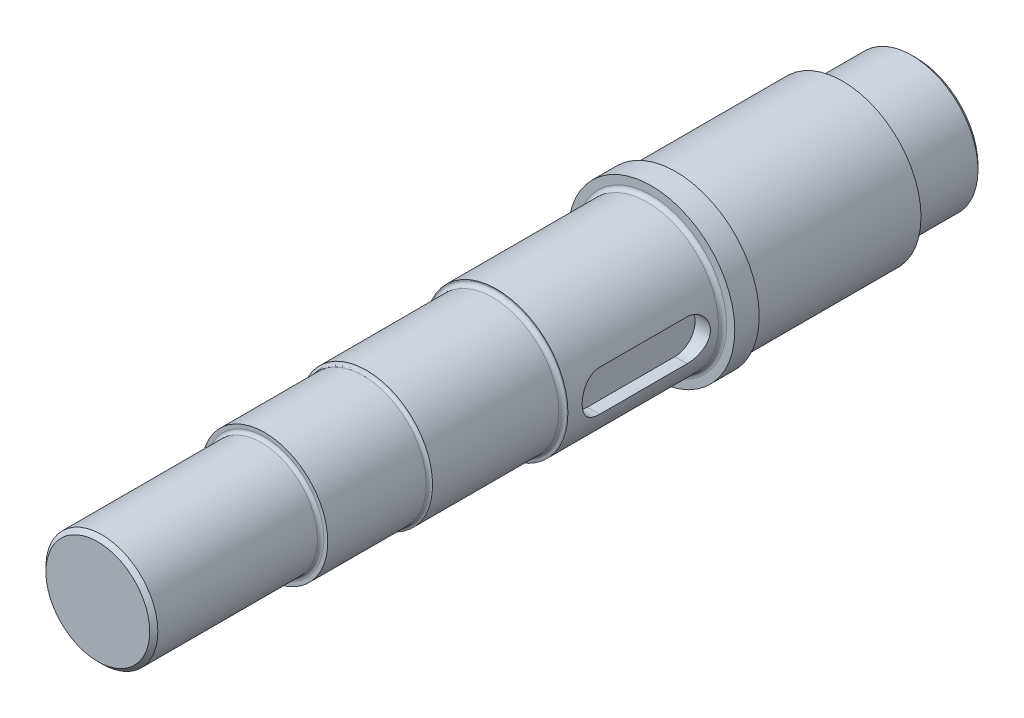
from build123d import *

# Parameters (mm, degrees)
SKETCH_1_R          = 32.5
EXTRUDE_1_DEPTH     = 36
SKETCH_2_R          = 38.5
EXTRUDE_2_DEPTH     = 82
SKETCH_3_R          = 41
EXTRUDE_3_DEPTH     = 12
SKETCH_4_R          = 35
EXTRUDE_4_DEPTH     = 76
SKETCH_5_R          = 32.5
EXTRUDE_5_DEPTH     = 64
SKETCH_6_R          = 31
EXTRUDE_6_DEPTH     = 50
SKETCH_7_R          = 27.5
EXTRUDE_7_DEPTH     = 82
FILLET_1_R          = 2
FILLET_2_R          = 1.6
CHAMFER_1_SIZE      = 2
CUT_EXTRUDE_1_DEPTH = 29


with BuildPart() as part:
    # 草图1 → 凸台-拉伸1 (new body)
    with BuildSketch(Plane.XY):
        Circle(SKETCH_1_R)
    extrude(amount=EXTRUDE_1_DEPTH)

    # 草图2 → 凸台-拉伸2 (add)
    with BuildSketch(Plane.XY.offset(36)):
        Circle(SKETCH_2_R)
    extrude(amount=EXTRUDE_2_DEPTH)

    # 草图3 → 凸台-拉伸3 (add)
    with BuildSketch(Plane.XY.offset(118)):
        Circle(SKETCH_3_R)
    extrude(amount=EXTRUDE_3_DEPTH)

    # 草图4 → 凸台-拉伸4 (add)
    with BuildSketch(Plane.XY.offset(130)):
        Circle(SKETCH_4_R)
    extrude(amount=EXTRUDE_4_DEPTH)

    # 草图5 → 凸台-拉伸5 (add)
    with BuildSketch(Plane.XY.offset(206)):
        Circle(SKETCH_5_R)
    extrude(amount=EXTRUDE_5_DEPTH)

    # 草图6 → 凸台-拉伸6 (add)
    with BuildSketch(Plane.XY.offset(270)):
        Circle(SKETCH_6_R)
    extrude(amount=EXTRUDE_6_DEPTH)

    # 草图7 → 凸台-拉伸7 (add)
    with BuildSketch(Plane.XY.offset(320)):
        Circle(SKETCH_7_R)
    extrude(amount=EXTRUDE_7_DEPTH)

    # 圆角1
    fillet_1_edges = [part.edges().sort_by_distance(p)[0] for p in [
        (-35, 0, 130),
        (-32.5, 0, 206),
    ]]
    fillet(fillet_1_edges, radius=FILLET_1_R)

    # 圆角2
    # the kernel refuses this fillet: 1.6 mm, written as the material it adds along each edge
    with BuildSketch(Plane(origin=(0, 0, 270), x_dir=(1, 0, 0), z_dir=(0, -1, 0))) as fillet_2_piece_1:
        with BuildLine():
            CenterArc((32.6, 1.596871942), FILLET_2_R, 180, 86.416678302)
            Line((31, 1.596871942), (30.968, 1.596871942))
            Line((30.968, 1.596871942), (30.968, 0))
            Line((30.968, 0), (31, -0.032))
            ThreePointArc((31, -0.032), (31.75, -0.032), (32.498, -0.031937439))
            Line((32.498, -0.031937439), (32.5, 0))
        make_face()
    revolve(axis=Axis((0, 0, 270), (0, 0, 1)))
    with BuildSketch(Plane(origin=(0, 0, 320), x_dir=(1, 0, 0), z_dir=(0, -1, 0))) as fillet_2_piece_2:
        with BuildLine():
            CenterArc((27.5 + FILLET_2_R, FILLET_2_R), FILLET_2_R, 180, 90)
            Line((27.5, FILLET_2_R), (27.5 - FILLET_2_R * 0.02, FILLET_2_R))
            Line((27.5 - FILLET_2_R * 0.02, FILLET_2_R), (27.5 - FILLET_2_R * 0.02, -FILLET_2_R * 0.02))
            Line((27.5 - FILLET_2_R * 0.02, -FILLET_2_R * 0.02), (27.5 + FILLET_2_R, -FILLET_2_R * 0.02))
            Line((27.5 + FILLET_2_R, -FILLET_2_R * 0.02), (27.5 + FILLET_2_R, 0))
        make_face()
    revolve(axis=Axis((0, 0, 320), (0, 0, 1)))

    # 倒角1
    chamfer_1_edges = [part.edges().sort_by_distance(p)[0] for p in [
        (-32.5, 0, 0),
        (-27.5, 0, 402),
    ]]
    chamfer(chamfer_1_edges, length=CHAMFER_1_SIZE)

    # 草图8 → 切除-拉伸1 (cut)
    with BuildSketch(Plane(origin=(27.5, 0, 0), x_dir=(0, 0, -1), z_dir=(1, 0, 0))):
        with BuildLine():
            Line((-189, 10), (-146, 10))
            ThreePointArc((-146, 10), (-136, 0), (-146, -10))
            Line((-146, -10), (-189, -10))
            ThreePointArc((-189, -10), (-199, 0), (-189, 10))
        make_face()
    extrude(amount=CUT_EXTRUDE_1_DEPTH, mode=Mode.SUBTRACT)


solid = part.part
